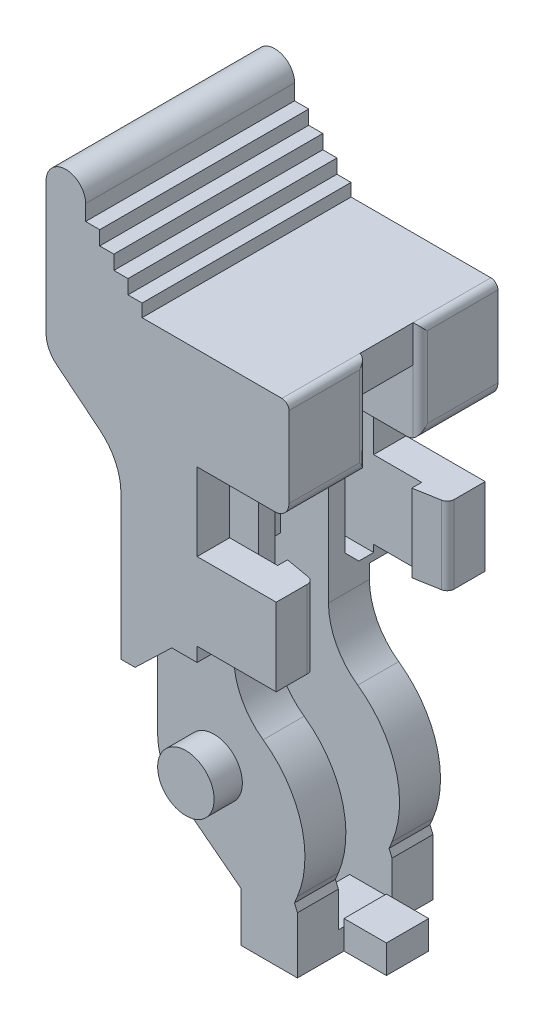
from build123d import *

# Parameters (mm, degrees)
SKETCH1_W                 = 1.5
SKETCH1_H                 = 1.5
BASE_BLOCK_DEPTH          = 1
SKETCH2_W                 = 4.8
SKETCH2_H                 = 0.75
BASE_BRIDGE_DEPTH         = 1.5
LOWER_SIDE_1_DEPTH        = 1.45
SKETCH6_R                 = 1
PIVOT_DEPTH               = 1
BODY_BLOCK_DEPTH          = 3.7
SKETCH8_W                 = 1.9
SKETCH8_H                 = 8.25
REAR_CUT_THROUGH_DEPTH    = 24.222672112
CLIP_FORMING_DEPTH        = 2.75
THROUGH_HOLES_DEPTH       = 23.941501695
SKETCH11_W                = 1.9
SKETCH11_H                = 7.5
PCB_SLOT_DEPTH            = 4.95
THROUGH_HOLE_REAR_1_DEPTH = 1.023508356
THROUGH_HOLE_REAR_2_DEPTH = 1.023508356
SKETCH15_W                = 1.9
SKETCH15_H                = 1.3
PCB_SLOT_TOP_DEPTH        = 0.25
REAR_FILLET_2MM_R         = 2
REAR_FILLET_1MM_R         = 1
GUIDE_FILLET_0_25MM_R     = 0.25
GUIDE_FILLET_0_5MM_R      = 0.5


# Some blends are built 0.0001 mm under size
with BuildPart() as part:
    # Sketch1 → Base Block (new body)
    with BuildSketch(Plane(origin=(0, 0, 0), x_dir=(1, 0, 0), z_dir=(0, 1, 0))):
        Rectangle(SKETCH1_W, SKETCH1_H)
    extrude(amount=BASE_BLOCK_DEPTH)

    # Sketch2 → Base Bridge (add)
    with BuildSketch(Plane.ZY.offset(0.75)):
        with Locations((0, 0.375)):
            Rectangle(SKETCH2_W, SKETCH2_H)
    extrude(amount=BASE_BRIDGE_DEPTH)

    # Sketch5 → Lower Side 1 (add)
    with BuildSketch(Plane.XY.offset(2.4)):
        with BuildLine():
            Line((-0.75, 0), (-2.75, 0))
            Line((-2.75, 0), (-2.75, 1.75))
            Line((-2.75, 1.75), (-4.917566413, 3.413326741))
            ThreePointArc((-4.917566413, 3.413326741), (-5.493757624, 4.115447239), (-5.7, 5))
            Line((-5.7, 5), (-5.7, 14))
            Line((-5.7, 14), (-8.35, 16.15))
            Line((-8.35, 16.15), (-8.35, 21.3))
            ThreePointArc((-8.35, 21.3), (-7.65, 22), (-6.95, 21.3))
            Line((-6.95, 21.3), (-6.95, 18.8))
            Line((-6.95, 18.8), (0.25, 18.8))
            Line((0.25, 18.8), (0.25, 15.2))
            Line((0.25, 15.2), (-3, 15.2))
            Line((-3, 15.2), (-3, 12.45))
            Line((-3, 12.45), (-0.2, 12.45))
            Line((-0.2, 12.45), (-0.2, 9.7))
            Line((-0.2, 9.7), (-3, 9.7))
            Line((-3, 9.7), (-3, 8.7))
            ThreePointArc((-3, 8.7), (-2.725432986, 7.572457553), (-1.963210212, 6.697383009))
            ThreePointArc((-1.963210212, 6.697383009), (-0.621213938, 4.811248727), (-0.75, 2.5))
            Line((-0.75, 2.5), (-0.853553391, 2.25))
            Line((-0.853553391, 2.25), (-0.75, 2))
            Line((-0.75, 2), (-0.75, 0))
        make_face()
    lower_side_1 = extrude(amount=-LOWER_SIDE_1_DEPTH)

    # Sketch6 → Pivot (add)
    with BuildSketch(Plane.XY.offset(2.4)):
        with Locations(Location((-3.7, 5, 0), (0, 0, 180))):
            Circle(SKETCH6_R)
    pivot = extrude(amount=PIVOT_DEPTH)

    # Lower Side 2: Lower Side 1, Pivot across plane
    add(lower_side_1.mirror(Plane.XY))
    add(pivot.mirror(Plane.XY))

    # Sketch7 → Body Block (add, symmetric)
    with BuildSketch(Plane.XY):
        with BuildLine():
            Line((-8.35, 16.15), (-5.7, 14))
            Line((-5.7, 14), (-5.7, 7.95))
            Line((-5.7, 7.95), (-5.2, 7.95))
            Line((-5.2, 7.95), (-3.9, 9.2))
            Line((-3.9, 9.2), (-3, 9.2))
            Line((-3, 9.2), (-3, 9.7))
            Line((-3, 9.7), (-0.2, 9.7))
            Line((-0.2, 9.7), (-0.2, 12.45))
            Line((-0.2, 12.45), (-3, 12.45))
            Line((-3, 12.45), (-3, 15.2))
            Line((-3, 15.2), (0.25, 15.2))
            Line((0.25, 15.2), (0.25, 18.8))
            Line((0.25, 18.8), (-4.95, 18.8))
            Line((-4.95, 18.8), (-4.95, 19.25))
            Line((-4.95, 19.25), (-5.45, 19.25))
            Line((-5.45, 19.25), (-5.45, 19.75))
            Line((-5.45, 19.75), (-5.95, 19.75))
            Line((-5.95, 19.75), (-5.95, 20.25))
            Line((-5.95, 20.25), (-6.45, 20.25))
            Line((-6.45, 20.25), (-6.45, 20.75))
            Line((-6.45, 20.75), (-6.95, 20.75))
            Line((-6.95, 20.75), (-6.95, 21.3))
            ThreePointArc((-6.95, 21.3), (-7.65, 22), (-8.35, 21.3))
            Line((-8.35, 21.3), (-8.35, 16.15))
        make_face()
    extrude(amount=BODY_BLOCK_DEPTH, both=True)

    # Sketch8 → Rear Cut Through (cut, through all)
    with BuildSketch(Plane.ZY.offset(5.7)):
        with Locations((0, 5.875)):
            Rectangle(SKETCH8_W, SKETCH8_H)
    extrude(amount=-REAR_CUT_THROUGH_DEPTH, mode=Mode.SUBTRACT)

    # Sketch9 → Clip Forming (cut)
    with BuildSketch(Plane(origin=(0, 12.45, 0), x_dir=(1, 0, 0), z_dir=(0, 1, 0))):
        with BuildLine():
            Line((-1.3, -2.2), (-0.406587956, -2.357532648))
            ThreePointArc((-0.406587956, -2.357532648), (-0.258488889, -2.443037684), (-0.2, -2.603734587))
            Line((-0.2, -2.603734587), (-0.2, 2.603734587))
            ThreePointArc((-0.2, 2.603734587), (-0.258488889, 2.443037684), (-0.406587956, 2.357532648))
            Line((-0.406587956, 2.357532648), (-1.3, 2.2))
            Line((-1.3, 2.2), (-1.3, 2.55))
            Line((-1.3, 2.55), (-3, 2.55))
            Line((-3, 2.55), (-3, -2.55))
            Line((-3, -2.55), (-1.3, -2.55))
            Line((-1.3, -2.55), (-1.3, -2.2))
        make_face()
    extrude(amount=-CLIP_FORMING_DEPTH, mode=Mode.SUBTRACT)

    # Sketch10 → Through Holes (cut, through all)
    with BuildSketch(Plane(origin=(-3, 0, 0), x_dir=(0, 0, -1), z_dir=(1, 0, 0))):
        Polygon((-2.55, 14.45), (-1.526491644, 14.45), (-1.526491644, 9.95), (-2.026491644, 9.45), (-2.55, 9.45), align=None)
        Polygon((2.55, 14.45), (2.55, 9.45), (2.026491644, 9.45), (1.526491644, 9.95), (1.526491644, 14.45), align=None)
    extrude(amount=-THROUGH_HOLES_DEPTH, mode=Mode.SUBTRACT)

    # Sketch11 → PCB Slot (cut)
    with BuildSketch(Plane(origin=(0.25, 0, 0), x_dir=(0, 0, -1), z_dir=(1, 0, 0))):
        with Locations((0, 13.75)):
            Rectangle(SKETCH11_W, SKETCH11_H)
    extrude(amount=-PCB_SLOT_DEPTH, mode=Mode.SUBTRACT)

    # Sketch13 → Through Hole Rear 1 (cut)
    with BuildSketch(Plane.XY.offset(-2.55)):
        Polygon((-8.35, 20.2), (-4, 16.5), (-4, 14.45), (-6.254651163, 14.45), (-8.35, 16.15), align=None)
    extrude(amount=THROUGH_HOLE_REAR_1_DEPTH, mode=Mode.SUBTRACT)

    # Sketch14 → Through Hole Rear 2 (cut)
    with BuildSketch(Plane(origin=(0, 0, 2.55), x_dir=(-1, 0, 0), z_dir=(0, 0, -1))):
        Polygon((8.35, 20.2), (4, 16.5), (4, 14.45), (6.254651163, 14.45), (8.35, 16.15), align=None)
    extrude(amount=THROUGH_HOLE_REAR_2_DEPTH, mode=Mode.SUBTRACT)

    # Sketch15 → PCB Slot Top (cut)
    with BuildSketch(Plane(origin=(0.25, 0, 0), x_dir=(0, 0, -1), z_dir=(1, 0, 0))):
        with Locations((0, 18.15)):
            Rectangle(SKETCH15_W, SKETCH15_H)
    extrude(amount=-PCB_SLOT_TOP_DEPTH, mode=Mode.SUBTRACT)

    # Rear Fillet (2mm)
    rear_fillet_2mm_edges = [part.edges().sort_by_distance(p)[0] for p in [
        (-5.7, 14, 3.125),
        (-5.7, 14, 0),
        (-5.7, 14, -3.125),
    ]]
    fillet(rear_fillet_2mm_edges, radius=REAR_FILLET_2MM_R)

    # Rear Fillet (1mm)
    rear_fillet_1mm_edges = [part.edges().sort_by_distance(p)[0] for p in [
        (-8.35, 16.15, 0),
        (-8.35, 16.15, -3.125),
        (-8.35, 16.15, 3.125),
    ]]
    fillet(rear_fillet_1mm_edges, radius=REAR_FILLET_1MM_R)

    # Guide Fillet (0.25mm)
    guide_fillet_0_25mm_edges = [part.edges().sort_by_distance(p)[0] for p in [
        (0.25, 17, -0.95),
        (0.25, 17, 0.95),
        (0.25, 18.8, -2.325),
        (0.25, 18.8, 2.325),
    ]]
    fillet(guide_fillet_0_25mm_edges, radius=GUIDE_FILLET_0_25MM_R - 0.0001)  # a hair under: the kernel refuses the full size

    # Guide Fillet (0.5mm)
    # the kernel refuses this fillet: 0.5 mm, written as the material it takes off along each edge
    with BuildSketch(Plane(origin=(0.25, 15.2, -4.95), x_dir=(-1, 0, 0), z_dir=(0, 0, 1))) as guide_fillet_0_5mm_piece_1:
        with BuildLine():
            CenterArc((GUIDE_FILLET_0_5MM_R, -GUIDE_FILLET_0_5MM_R), GUIDE_FILLET_0_5MM_R, 90, 90)
            Line((0, -GUIDE_FILLET_0_5MM_R), (0, 0))
            Line((0, 0), (GUIDE_FILLET_0_5MM_R, 0))
        make_face()
    extrude(amount=5.0001, mode=Mode.SUBTRACT)
    with BuildSketch(Plane(origin=(0.25, 15.2, -0.0501), x_dir=(0, 1, 0), z_dir=(0, 0, 1))) as guide_fillet_0_5mm_piece_2:
        with BuildLine():
            CenterArc((GUIDE_FILLET_0_5MM_R, GUIDE_FILLET_0_5MM_R), GUIDE_FILLET_0_5MM_R, 180, 90)
            Line((0, GUIDE_FILLET_0_5MM_R), (0, 0))
            Line((0, 0), (GUIDE_FILLET_0_5MM_R, 0))
        make_face()
    extrude(amount=5.0001, mode=Mode.SUBTRACT)


solid = part.part
